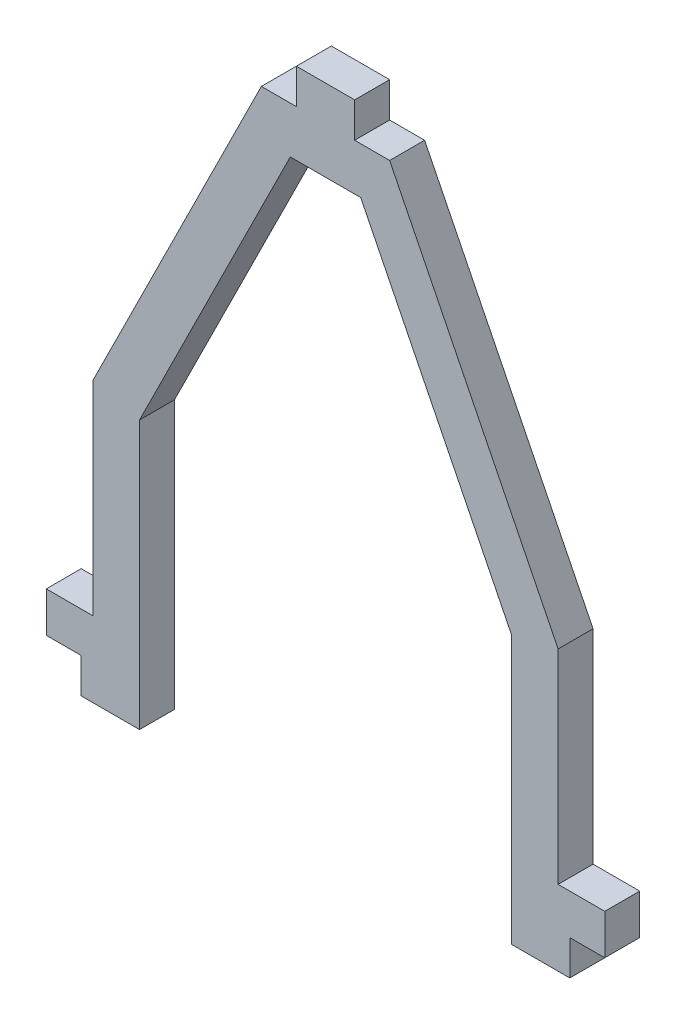
from build123d import *

# Parameters (mm, degrees)
BOSS_EXTRUDE1_DEPTH = 3


with BuildPart() as part:
    # Sketch1 → Boss-Extrude1 (new body)
    with BuildSketch(Plane.XY):
        Polygon((-6.383894407, -51.093441029), (-6.383894407, -28.093441029), (6.544354466, -2.093441029), (12.58785672, -2.093441029), (25.516105593, -28.093441029), (25.516105593, -51.093441029), (30.516105593, -51.093441029), (30.516105593, -48.093441029), (33.516105593, -48.093441029), (33.516105593, -44.638769888), (29.516105593, -44.638769888), (29.516105593, -27.153834566), (15.066105593, 1.906558971), (12.066105593, 1.906558971), (12.066105593, 4.906558971), (7.066105593, 4.906558971), (7.066105593, 1.906558971), (4.066105593, 1.906558971), (-10.383894407, -27.153834566), (-10.383894407, -44.638769888), (-14.383894407, -44.638769888), (-14.383894407, -48.093441029), (-11.383894407, -48.093441029), (-11.383894407, -51.093441029), align=None)
    extrude(amount=BOSS_EXTRUDE1_DEPTH)


solid = part.part
